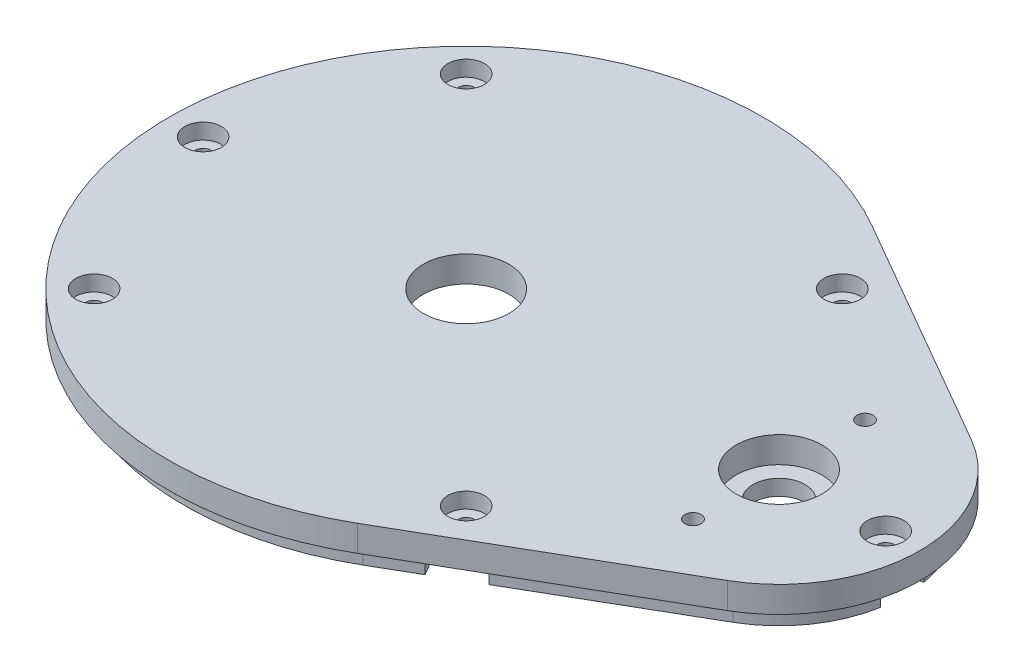
from build123d import *

# Parameters (mm, degrees)
SKETCH1_R           = 8.2
SKETCH1_R_2         = 1.55
BOSS_EXTRUDE1_DEPTH = 5
SKETCH2_R           = 12
SKETCH2_R_2         = 5
BOSS_EXTRUDE2_DEPTH = 3
BOSS_EXTRUDE3_DEPTH = 4
SKETCH5_R           = 1.55
CUT_EXTRUDE1_DEPTH  = 5
SKETCH6_R           = 3.5
CUT_EXTRUDE2_DEPTH  = 3


with BuildPart() as part:
    # Sketch1 → Boss-Extrude1 (new body)
    with BuildSketch(Plane(origin=(0, 0, 0), x_dir=(1, 0, 0), z_dir=(0, 1, 0))):
        with BuildLine():
            Line((13.5, -49.363448016), (58.5, -23.382685902))
            ThreePointArc((58.5, -23.382685902), (72, 0), (58.5, 23.382685902))
            Line((58.5, 23.382685902), (13.5, 49.363448016))
            ThreePointArc((13.5, 49.363448016), (-72, 0), (13.5, -49.363448016))
        make_face()
        with Locations((-15, 0)):
            Circle(SKETCH1_R, mode=Mode.SUBTRACT)
        with Locations((45, 0)):
            Circle(SKETCH1_R, mode=Mode.SUBTRACT)
        with Locations((45, 16.5)):
            Circle(SKETCH1_R_2, mode=Mode.SUBTRACT)
        with Locations((45, -16.5)):
            Circle(SKETCH1_R_2, mode=Mode.SUBTRACT)
    extrude(amount=BOSS_EXTRUDE1_DEPTH)

    # Sketch2 → Boss-Extrude2 (add)
    with BuildSketch(Plane.XZ):
        with Locations((45, 0)):
            Circle(SKETCH2_R)
        with Locations((45, 0)):
            Circle(SKETCH2_R_2, mode=Mode.SUBTRACT)
    extrude(amount=BOSS_EXTRUDE2_DEPTH)

    # Sketch4 → Boss-Extrude3 (add)
    with BuildSketch(Plane.XZ):
        with BuildLine():
            Line((12, -46.765371804), (19.534222953, -42.415486154))
            Line((19.534222953, -42.415486154), (18.534222953, -40.683435347))
            Line((18.534222953, -40.683435347), (11, -45.033320997))
            ThreePointArc((11, -45.033320997), (-19.532098623, -51.802124301), (-48.424955704, -39.834311042))
            Line((-48.424955704, -39.834311042), (-49.710530923, -41.366399928))
            ThreePointArc((-49.710530923, -41.366399928), (-19.706410108, -53.794513697), (12, -46.765371804))
        make_face()
        with BuildLine():
            Line((68.635386072, -4.167556264), (66.665770566, -3.820259909))
            ThreePointArc((66.665770566, -3.820259909), (63.021344974, -12.6186816), (56, -19.052558883))
            Line((56, -19.052558883), (26.328451587, -36.183435347))
            Line((26.328451587, -36.183435347), (27.328451587, -37.915486154))
            Line((27.328451587, -37.915486154), (57, -20.784609691))
            ThreePointArc((57, -20.784609691), (64.659649063, -13.765834472), (68.635386072, -4.167556264))
        make_face()
        with BuildLine():
            Line((66.665770566, 3.820259909), (68.635386072, 4.167556264))
            ThreePointArc((68.635386072, 4.167556264), (64.659649063, 13.765834472), (57, 20.784609691))
            Line((57, 20.784609691), (27.328451587, 37.915486154))
            Line((27.328451587, 37.915486154), (26.328451587, 36.183435347))
            Line((26.328451587, 36.183435347), (56, 19.052558883))
            ThreePointArc((56, 19.052558883), (63.021344974, 12.6186816), (66.665770566, 3.820259909))
        make_face()
        with BuildLine():
            Line((-49.710530923, 41.366399928), (-48.424955704, 39.834311042))
            ThreePointArc((-48.424955704, 39.834311042), (-19.532098623, 51.802124301), (11, 45.033320997))
            Line((11, 45.033320997), (18.534222953, 40.683435347))
            Line((18.534222953, 40.683435347), (19.534222953, 42.415486154))
            Line((19.534222953, 42.415486154), (12, 46.765371804))
            ThreePointArc((12, 46.765371804), (-19.706410108, 53.794513697), (-49.710530923, 41.366399928))
        make_face()
        with BuildLine():
            Line((-54.834311042, 33.424955704), (-56.366399928, 34.710530923))
            ThreePointArc((-56.366399928, 34.710530923), (-64.889494756, 20.664905348), (-68.794513697, 4.706410108))
            Line((-68.794513697, 4.706410108), (-66.802124301, 4.532098623))
            ThreePointArc((-66.802124301, 4.532098623), (-63.041735691, 19.899538483), (-54.834311042, 33.424955704))
        make_face()
        with BuildLine():
            Line((-68.794513697, -4.706410109), (-66.802124301, -4.532098623))
            ThreePointArc((-66.802124301, -4.532098623), (-63.041735691, -19.899538483), (-54.834311042, -33.424955704))
            Line((-54.834311042, -33.424955704), (-56.366399928, -34.710530923))
            ThreePointArc((-56.366399928, -34.710530923), (-64.889494756, -20.664905348), (-68.794513697, -4.706410109))
        make_face()
    extrude(amount=BOSS_EXTRUDE3_DEPTH)

    # Sketch5 → Cut-Extrude1 (cut)
    with BuildSketch(Plane(origin=(0, 5, 0), x_dir=(1, 0, 0), z_dir=(0, 1, 0))):
        with Locations((-65.45, 0)):
            Circle(SKETCH5_R)
        with Locations((65.45, 0)):
            Circle(SKETCH5_R)
        with Locations((-50.673537111, -35.673537111)):
            Circle(SKETCH5_R)
        with Locations((21.062445841, 36.062445841)):
            Circle(SKETCH5_R)
        with Locations((21.062445841, -36.062445841)):
            Circle(SKETCH5_R)
        with Locations((-50.673537111, 35.673537111)):
            Circle(SKETCH5_R)
    extrude(amount=-CUT_EXTRUDE1_DEPTH, mode=Mode.SUBTRACT)

    # Sketch6 → Cut-Extrude2 (cut)
    with BuildSketch(Plane(origin=(0, 5, 0), x_dir=(1, 0, 0), z_dir=(0, 1, 0))):
        with Locations((-50.673537111, 35.673537111)):
            Circle(SKETCH6_R)
        with Locations((-65.45, 0)):
            Circle(SKETCH6_R)
        with Locations((-50.673537111, -35.673537111)):
            Circle(SKETCH6_R)
        with Locations((21.062445841, -36.062445841)):
            Circle(SKETCH6_R)
        with Locations((21.062445841, 36.062445841)):
            Circle(SKETCH6_R)
        with Locations((65.45, 0)):
            Circle(SKETCH6_R)
    extrude(amount=-CUT_EXTRUDE2_DEPTH, mode=Mode.SUBTRACT)


solid = part.part
